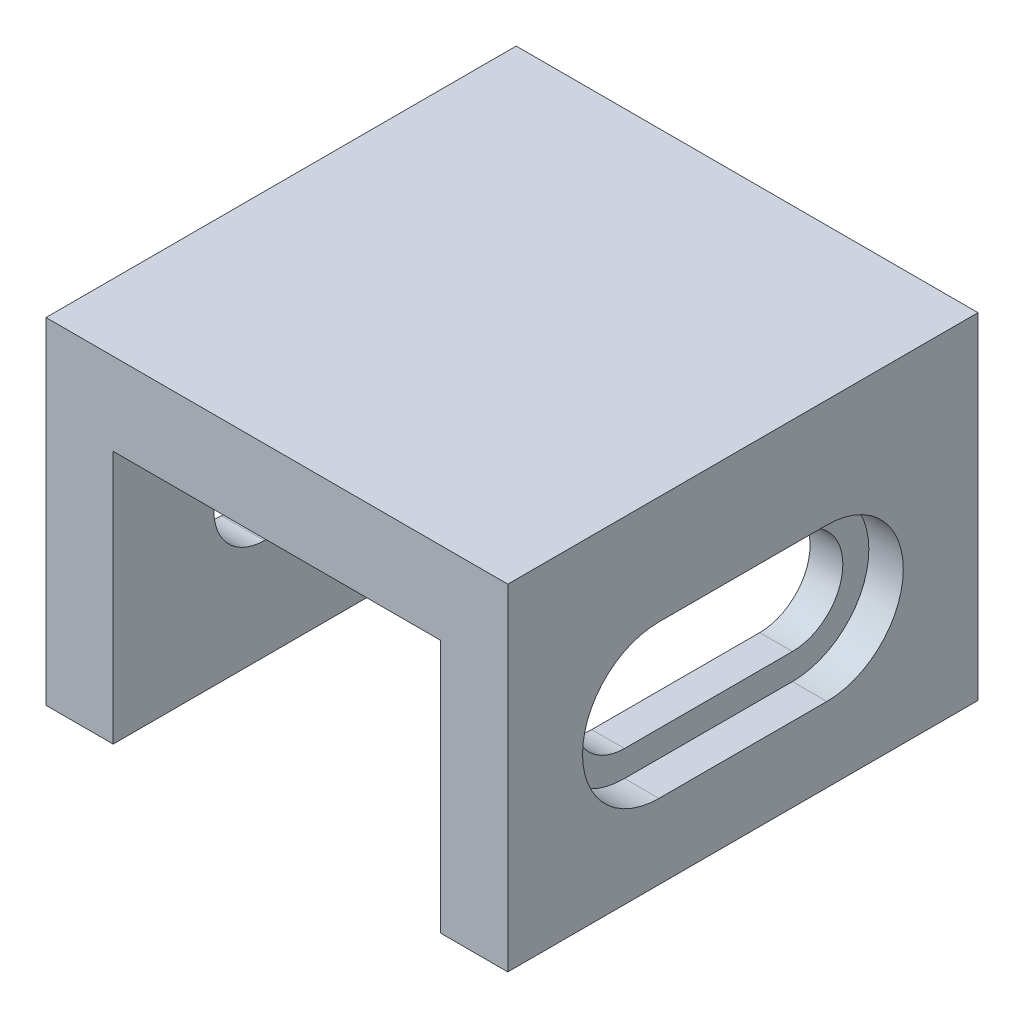
from build123d import *

# Parameters (mm, degrees)
SKETCH1_W           = 27.5
SKETCH1_H           = 28
BOSS_EXTRUDE1_DEPTH = 20
CUT_EXTRUDE1_DEPTH  = 27.5
CUT_EXTRUDE2_DEPTH  = 1.45
CUT_EXTRUDE3_START  = -2.05
CUT_EXTRUDE3_DEPTH  = 2.05
SKETCH5_W           = 19.5
SKETCH5_H           = 28
CUT_EXTRUDE4_DEPTH  = 15.1


with BuildPart() as part:
    # Sketch1 → Boss-Extrude1 (new body)
    with BuildSketch(Plane(origin=(0, 0, 0), x_dir=(1, 0, 0), z_dir=(0, 1, 0))):
        with Locations((13.75, 14)):
            Rectangle(SKETCH1_W, SKETCH1_H)
    extrude(amount=BOSS_EXTRUDE1_DEPTH)

    # Sketch2 → Cut-Extrude1 (cut)
    with BuildSketch(Plane.ZY):
        with BuildLine():
            Line((-19, 12), (-9, 12))
            ThreePointArc((-9, 12), (-6, 9), (-9, 6))
            Line((-9, 6), (-19, 6))
            ThreePointArc((-19, 6), (-22, 9), (-19, 12))
        make_face()
    extrude(amount=-CUT_EXTRUDE1_DEPTH, mode=Mode.SUBTRACT)

    # Sketch3 → Cut-Extrude2 (cut)
    with BuildSketch(Plane.ZY):
        with BuildLine():
            Line((-19, 13.55), (-9, 13.55))
            ThreePointArc((-9, 13.55), (-4.45, 9), (-9, 4.45))
            Line((-9, 4.45), (-19, 4.45))
            ThreePointArc((-19, 4.45), (-23.55, 9), (-19, 13.55))
        make_face()
    extrude(amount=-CUT_EXTRUDE2_DEPTH, mode=Mode.SUBTRACT)

    # Sketch4 → Cut-Extrude3 (cut)
    with BuildSketch(Plane(origin=(27.5, 0, 0), x_dir=(0, 0, -1), z_dir=(1, 0, 0)).offset(CUT_EXTRUDE3_START)):
        with BuildLine():
            Line((9, 13.55), (19, 13.55))
            ThreePointArc((19, 13.55), (23.55, 9), (19, 4.45))
            Line((19, 4.45), (9, 4.45))
            ThreePointArc((9, 4.45), (4.45, 9), (9, 13.55))
        make_face()
    extrude(amount=CUT_EXTRUDE3_DEPTH, mode=Mode.SUBTRACT)

    # Sketch5 → Cut-Extrude4 (cut)
    with BuildSketch(Plane(origin=(0, 0, 0), x_dir=(1, 0, 0), z_dir=(0, 1, 0))):
        with Locations((13.75, 14)):
            Rectangle(SKETCH5_W, SKETCH5_H)
    extrude(amount=CUT_EXTRUDE4_DEPTH, mode=Mode.SUBTRACT)


solid = part.part
